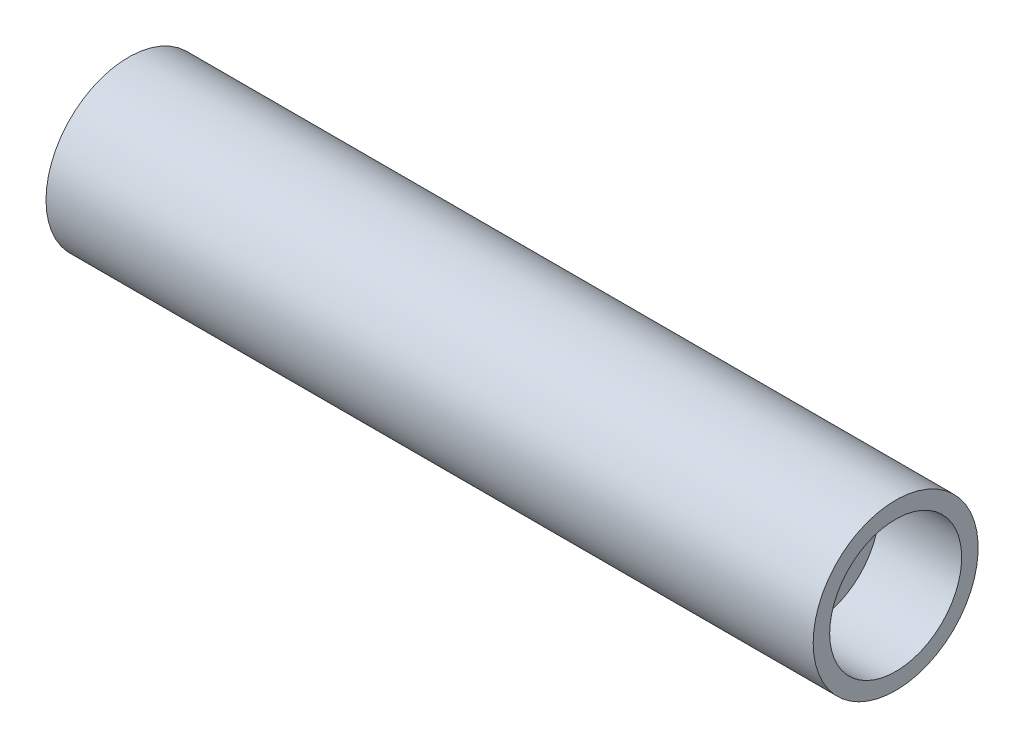
from build123d import *


with BuildPart() as part:
    # Sketch2 → Revolve1 (revolve)
    with BuildSketch(Plane(origin=(0, 0, 0), x_dir=(1, 0, 0), z_dir=(0, 1, 0))):
        Polygon((0, 5), (36.5, 5), (36.5, 8), (46.5, 8), (46.5, 10), (0, 10), align=None)
    revolve1 = revolve(axis=Axis((0, 0, 0), (1, 0, 0)))

    # Mirror1: Revolve1 across plane
    add(revolve1.mirror(Plane(origin=(0, 0, -10), x_dir=(0, 0, 1), z_dir=(1, 0, 0))))


solid = part.part
